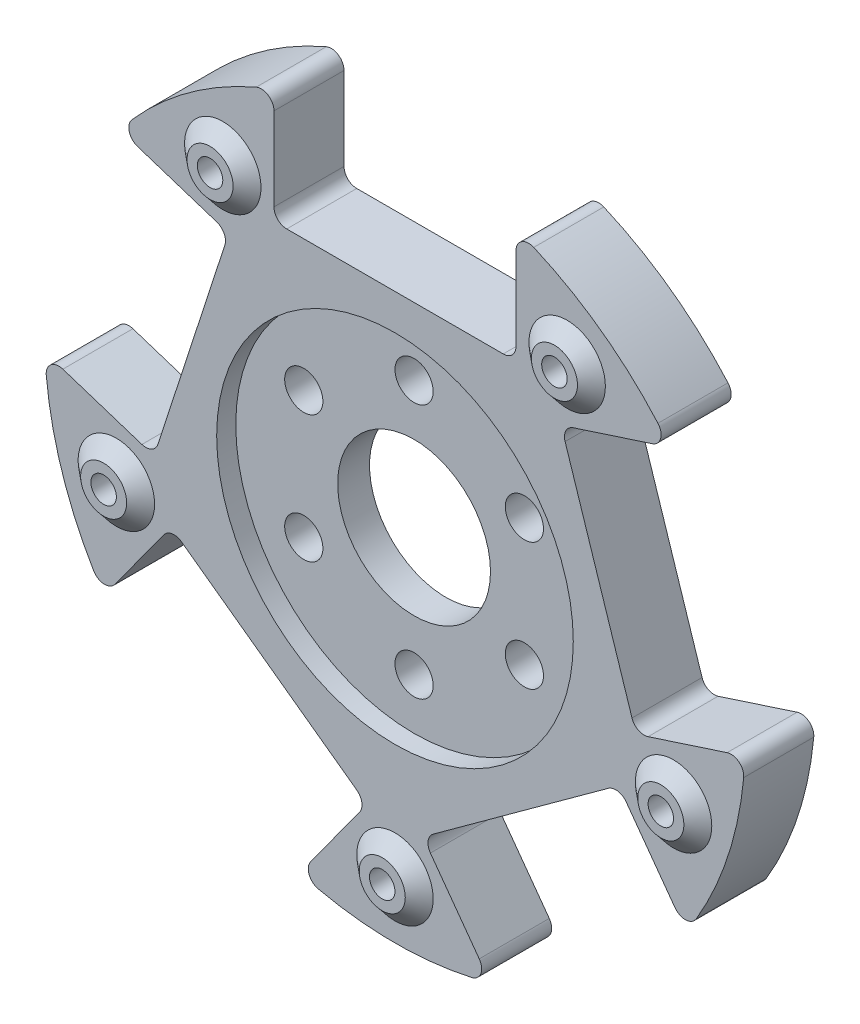
from build123d import *

# Parameters (mm, degrees)
SKETCH2_R                     = 14
BOSS_EXTRUDE1_DEPTH           = 2.75
SKETCH2_3_R                   = 14
SKETCH2_3_R_2                 = 1.5
SKETCH2_3_R_3                 = 6
BOSS_EXTRUDE2_DEPTH           = 1.25
FILLET1_R                     = 1
SKETCH3_R                     = 3
BOSS_EXTRUDE3_DEPTH           = 1
BOSS_EXTRUDE3_DRAFT           = 50
BOSS_EXTRUDE3_PROFILE_2_DEPTH = 1
BOSS_EXTRUDE3_PROFILE_2_DRAFT = 50
BOSS_EXTRUDE3_PROFILE_3_DEPTH = 1
BOSS_EXTRUDE3_PROFILE_3_DRAFT = 50
BOSS_EXTRUDE3_PROFILE_4_DEPTH = 1
BOSS_EXTRUDE3_PROFILE_4_DRAFT = 50
BOSS_EXTRUDE3_PROFILE_5_DEPTH = 1
BOSS_EXTRUDE3_PROFILE_5_DRAFT = 50
SKETCH4_R                     = 1
CUT_EXTRUDE1_DEPTH            = 2
SKETCH5_R                     = 3
BOSS_EXTRUDE5_DEPTH           = 1
BOSS_EXTRUDE5_DRAFT           = 50
BOSS_EXTRUDE5_PROFILE_2_DEPTH = 1
BOSS_EXTRUDE5_PROFILE_2_DRAFT = 50
BOSS_EXTRUDE5_PROFILE_3_DEPTH = 1
BOSS_EXTRUDE5_PROFILE_3_DRAFT = 50
BOSS_EXTRUDE5_PROFILE_4_DEPTH = 1
BOSS_EXTRUDE5_PROFILE_4_DRAFT = 50
BOSS_EXTRUDE5_PROFILE_5_DEPTH = 1
BOSS_EXTRUDE5_PROFILE_5_DRAFT = 50
CUT_EXTRUDE2_START            = -1
SKETCH6_R                     = 1
CUT_EXTRUDE2_DEPTH            = 1


with BuildPart() as part:
    # Sketch2 → Boss-Extrude1 (new, symmetric)
    with BuildSketch(Plane.XY):
        with BuildLine():
            Line((-9.5, 16.806975801), (-9.5, 25.806975801))
            ThreePointArc((-9.5, 25.806975801), (-16.164094438, 22.247967345), (-21.608231055, 17.009831001))
            Line((-21.608231055, 17.009831001), (-13.048722408, 14.228678051))
            Line((-13.048722408, 14.228678051), (-18.920045301, -3.841395758))
            Line((-18.920045301, -3.841395758), (-27.479553948, -1.060242809))
            ThreePointArc((-27.479553948, -1.060242809), (-26.154054198, -8.497967345), (-22.854621229, -15.2943221))
            Line((-22.854621229, -15.2943221), (-17.564553958, -8.01316915))
            Line((-17.564553958, -8.01316915), (-2.193231065, -19.181088944))
            Line((-2.193231065, -19.181088944), (-7.483298336, -26.462241893))
            ThreePointArc((-7.483298336, -26.462241893), (0, -27.5), (7.483298336, -26.462241893))
            Line((7.483298336, -26.462241893), (2.193231065, -19.181088944))
            Line((2.193231065, -19.181088944), (17.564553958, -8.01316915))
            Line((17.564553958, -8.01316915), (22.854621229, -15.2943221))
            ThreePointArc((22.854621229, -15.2943221), (26.154054198, -8.497967345), (27.479553948, -1.060242809))
            Line((27.479553948, -1.060242809), (18.920045301, -3.841395758))
            Line((18.920045301, -3.841395758), (13.048722408, 14.228678051))
            Line((13.048722408, 14.228678051), (21.608231055, 17.009831001))
            ThreePointArc((21.608231055, 17.009831001), (16.164094438, 22.247967345), (9.5, 25.806975801))
            Line((9.5, 25.806975801), (9.5, 16.806975801))
            Line((9.5, 16.806975801), (-9.5, 16.806975801))
        make_face()
        Circle(SKETCH2_R, mode=Mode.SUBTRACT)
    extrude(amount=BOSS_EXTRUDE1_DEPTH, both=True)

    # Sketch2<3> → Boss-Extrude2 (add, symmetric)
    with BuildSketch(Plane.XY):
        Circle(SKETCH2_3_R)
        with Locations((0, -10)):
            Circle(SKETCH2_3_R_2, mode=Mode.SUBTRACT)
        with Locations((-8.660254038, -5)):
            Circle(SKETCH2_3_R_2, mode=Mode.SUBTRACT)
        with Locations((8.660254038, -5)):
            Circle(SKETCH2_3_R_2, mode=Mode.SUBTRACT)
        with Locations((-8.660254038, 5)):
            Circle(SKETCH2_3_R_2, mode=Mode.SUBTRACT)
        Circle(SKETCH2_3_R_3, mode=Mode.SUBTRACT)
        with Locations((8.660254038, 5)):
            Circle(SKETCH2_3_R_2, mode=Mode.SUBTRACT)
        with Locations((0, 10)):
            Circle(SKETCH2_3_R_2, mode=Mode.SUBTRACT)
    extrude(amount=BOSS_EXTRUDE2_DEPTH, both=True)

    # Fillet1
    fillet1_edges = [part.edges().sort_by_distance(p)[0] for p in [
        (-18.920045301, -3.841395758, 0),
        (-13.048722408, 14.228678051, 0),
        (-17.564553958, -8.01316915, 0),
        (-2.193231065, -19.181088944, 0),
        (17.564553958, -8.01316915, 0),
        (2.193231065, -19.181088944, 0),
        (18.920045301, -3.841395758, 0),
        (13.048722408, 14.228678051, 0),
        (9.5, 16.806975801, 0),
        (-9.5, 16.806975801, 0),
        (-9.5, 25.806975801, 0),
        (9.5, 25.806975801, 0),
        (21.608231055, 17.009831001, 0),
        (27.479553948, -1.060242809, 0),
        (22.854621229, -15.2943221, 0),
        (7.483298336, -26.462241893, 0),
        (-7.483298336, -26.462241893, 0),
        (-22.854621229, -15.2943221, 0),
        (-27.479553948, -1.060242809, 0),
        (-21.608231055, 17.009831001, 0),
    ]]
    fillet(fillet1_edges, radius=FILLET1_R)


with BuildPart() as boss_extrude3_tool:
    # Sketch3 → Boss-Extrude3 (with draft: the straight prism first)
    with BuildSketch(Plane.XY.offset(2.75)):
        with Locations((13.519060803, 18.607390871)):
            Circle(SKETCH3_R)
    extrude(amount=BOSS_EXTRUDE3_DEPTH)
    # Boss-Extrude3: the draft: its side faces are tilted about the plane it starts from
    boss_extrude3_sides = [boss_extrude3_tool.faces().sort_by_distance(p)[0] for p in [
        (10.519060803, 18.607390871, 3.25),
    ]]
    draft(boss_extrude3_sides, Plane.XY.offset(2.75), BOSS_EXTRUDE3_DRAFT)


with BuildPart() as part_1:
    add(part.part)

    # Boss-Extrude3: add boss_extrude3_tool
    add(boss_extrude3_tool.part)


with BuildPart() as boss_extrude3_profile_2_tool:
    # Sketch3 → Boss-Extrude3 profile 2 (with draft: the straight prism first)
    with BuildSketch(Plane.XY.offset(2.75)):
        with Locations((21.874299875, -7.107390871)):
            Circle(SKETCH3_R)
    extrude(amount=BOSS_EXTRUDE3_PROFILE_2_DEPTH)
    # Boss-Extrude3 profile 2: the draft: its side faces are tilted about the plane it starts from
    boss_extrude3_profile_2_sides = [boss_extrude3_profile_2_tool.faces().sort_by_distance(p)[0] for p in [
        (18.874299875, -7.107390871, 3.25),
    ]]
    draft(boss_extrude3_profile_2_sides, Plane.XY.offset(2.75), BOSS_EXTRUDE3_PROFILE_2_DRAFT)


with BuildPart() as part_2:
    add(part_1.part)

    # Boss-Extrude3 profile 2: add boss_extrude3_profile_2_tool
    add(boss_extrude3_profile_2_tool.part)


with BuildPart() as boss_extrude3_profile_3_tool:
    # Sketch3 → Boss-Extrude3 profile 3 (with draft: the straight prism first)
    with BuildSketch(Plane.XY.offset(2.75)):
        with Locations((0, -23)):
            Circle(SKETCH3_R)
    extrude(amount=BOSS_EXTRUDE3_PROFILE_3_DEPTH)
    # Boss-Extrude3 profile 3: the draft: its side faces are tilted about the plane it starts from
    boss_extrude3_profile_3_sides = [boss_extrude3_profile_3_tool.faces().sort_by_distance(p)[0] for p in [
        (-3, -23, 3.25),
    ]]
    draft(boss_extrude3_profile_3_sides, Plane.XY.offset(2.75), BOSS_EXTRUDE3_PROFILE_3_DRAFT)


with BuildPart() as part_3:
    add(part_2.part)

    # Boss-Extrude3 profile 3: add boss_extrude3_profile_3_tool
    add(boss_extrude3_profile_3_tool.part)


with BuildPart() as boss_extrude3_profile_4_tool:
    # Sketch3 → Boss-Extrude3 profile 4 (with draft: the straight prism first)
    with BuildSketch(Plane.XY.offset(2.75)):
        with Locations((-21.874299875, -7.107390871)):
            Circle(SKETCH3_R)
    extrude(amount=BOSS_EXTRUDE3_PROFILE_4_DEPTH)
    # Boss-Extrude3 profile 4: the draft: its side faces are tilted about the plane it starts from
    boss_extrude3_profile_4_sides = [boss_extrude3_profile_4_tool.faces().sort_by_distance(p)[0] for p in [
        (-24.874299875, -7.107390871, 3.25),
    ]]
    draft(boss_extrude3_profile_4_sides, Plane.XY.offset(2.75), BOSS_EXTRUDE3_PROFILE_4_DRAFT)


with BuildPart() as part_4:
    add(part_3.part)

    # Boss-Extrude3 profile 4: add boss_extrude3_profile_4_tool
    add(boss_extrude3_profile_4_tool.part)


with BuildPart() as boss_extrude3_profile_5_tool:
    # Sketch3 → Boss-Extrude3 profile 5 (with draft: the straight prism first)
    with BuildSketch(Plane.XY.offset(2.75)):
        with Locations((-13.519060803, 18.607390871)):
            Circle(SKETCH3_R)
    extrude(amount=BOSS_EXTRUDE3_PROFILE_5_DEPTH)
    # Boss-Extrude3 profile 5: the draft: its side faces are tilted about the plane it starts from
    boss_extrude3_profile_5_sides = [boss_extrude3_profile_5_tool.faces().sort_by_distance(p)[0] for p in [
        (-16.519060803, 18.607390871, 3.25),
    ]]
    draft(boss_extrude3_profile_5_sides, Plane.XY.offset(2.75), BOSS_EXTRUDE3_PROFILE_5_DRAFT)


with BuildPart() as part_5:
    add(part_4.part)

    # Boss-Extrude3 profile 5: add boss_extrude3_profile_5_tool
    add(boss_extrude3_profile_5_tool.part)

    # Sketch4 → Cut-Extrude1 (cut)
    with BuildSketch(Plane.XY.offset(3.75)):
        with Locations((13.519060803, 18.607390871)):
            Circle(SKETCH4_R)
        with Locations((21.874299875, -7.107390871)):
            Circle(SKETCH4_R)
        with Locations((0, -23)):
            Circle(SKETCH4_R)
        with Locations((-21.874299875, -7.107390871)):
            Circle(SKETCH4_R)
        with Locations((-13.519060803, 18.607390871)):
            Circle(SKETCH4_R)
    extrude(amount=-CUT_EXTRUDE1_DEPTH, mode=Mode.SUBTRACT)


with BuildPart() as boss_extrude5_tool:
    # Sketch5 → Boss-Extrude5 (with draft: the straight prism first)
    with BuildSketch(Plane(origin=(0, 0, -2.75), x_dir=(-1, 0, 0), z_dir=(0, 0, -1))):
        with Locations((13.519060803, 18.607390871)):
            Circle(SKETCH5_R)
    extrude(amount=BOSS_EXTRUDE5_DEPTH)
    # Boss-Extrude5: the draft: its side faces are tilted about the plane it starts from
    boss_extrude5_sides = [boss_extrude5_tool.faces().sort_by_distance(p)[0] for p in [
        (-10.519060803, 18.607390871, -3.25),
    ]]
    draft(boss_extrude5_sides, Plane(origin=(0, 0, -2.75), x_dir=(-1, 0, 0), z_dir=(0, 0, -1)), BOSS_EXTRUDE5_DRAFT)


with BuildPart() as part_6:
    add(part_5.part)

    # Boss-Extrude5: add boss_extrude5_tool
    add(boss_extrude5_tool.part)


with BuildPart() as boss_extrude5_profile_2_tool:
    # Sketch5 → Boss-Extrude5 profile 2 (with draft: the straight prism first)
    with BuildSketch(Plane(origin=(0, 0, -2.75), x_dir=(-1, 0, 0), z_dir=(0, 0, -1))):
        with Locations((21.874299875, -7.107390871)):
            Circle(SKETCH5_R)
    extrude(amount=BOSS_EXTRUDE5_PROFILE_2_DEPTH)
    # Boss-Extrude5 profile 2: the draft: its side faces are tilted about the plane it starts from
    boss_extrude5_profile_2_sides = [boss_extrude5_profile_2_tool.faces().sort_by_distance(p)[0] for p in [
        (-18.874299875, -7.107390871, -3.25),
    ]]
    draft(boss_extrude5_profile_2_sides, Plane(origin=(0, 0, -2.75), x_dir=(-1, 0, 0), z_dir=(0, 0, -1)), BOSS_EXTRUDE5_PROFILE_2_DRAFT)


with BuildPart() as part_7:
    add(part_6.part)

    # Boss-Extrude5 profile 2: add boss_extrude5_profile_2_tool
    add(boss_extrude5_profile_2_tool.part)


with BuildPart() as boss_extrude5_profile_3_tool:
    # Sketch5 → Boss-Extrude5 profile 3 (with draft: the straight prism first)
    with BuildSketch(Plane(origin=(0, 0, -2.75), x_dir=(-1, 0, 0), z_dir=(0, 0, -1))):
        with Locations((0, -23)):
            Circle(SKETCH5_R)
    extrude(amount=BOSS_EXTRUDE5_PROFILE_3_DEPTH)
    # Boss-Extrude5 profile 3: the draft: its side faces are tilted about the plane it starts from
    boss_extrude5_profile_3_sides = [boss_extrude5_profile_3_tool.faces().sort_by_distance(p)[0] for p in [
        (3, -23, -3.25),
    ]]
    draft(boss_extrude5_profile_3_sides, Plane(origin=(0, 0, -2.75), x_dir=(-1, 0, 0), z_dir=(0, 0, -1)), BOSS_EXTRUDE5_PROFILE_3_DRAFT)


with BuildPart() as part_8:
    add(part_7.part)

    # Boss-Extrude5 profile 3: add boss_extrude5_profile_3_tool
    add(boss_extrude5_profile_3_tool.part)


with BuildPart() as boss_extrude5_profile_4_tool:
    # Sketch5 → Boss-Extrude5 profile 4 (with draft: the straight prism first)
    with BuildSketch(Plane(origin=(0, 0, -2.75), x_dir=(-1, 0, 0), z_dir=(0, 0, -1))):
        with Locations((-21.874299875, -7.107390871)):
            Circle(SKETCH5_R)
    extrude(amount=BOSS_EXTRUDE5_PROFILE_4_DEPTH)
    # Boss-Extrude5 profile 4: the draft: its side faces are tilted about the plane it starts from
    boss_extrude5_profile_4_sides = [boss_extrude5_profile_4_tool.faces().sort_by_distance(p)[0] for p in [
        (24.874299875, -7.107390871, -3.25),
    ]]
    draft(boss_extrude5_profile_4_sides, Plane(origin=(0, 0, -2.75), x_dir=(-1, 0, 0), z_dir=(0, 0, -1)), BOSS_EXTRUDE5_PROFILE_4_DRAFT)


with BuildPart() as part_9:
    add(part_8.part)

    # Boss-Extrude5 profile 4: add boss_extrude5_profile_4_tool
    add(boss_extrude5_profile_4_tool.part)


with BuildPart() as boss_extrude5_profile_5_tool:
    # Sketch5 → Boss-Extrude5 profile 5 (with draft: the straight prism first)
    with BuildSketch(Plane(origin=(0, 0, -2.75), x_dir=(-1, 0, 0), z_dir=(0, 0, -1))):
        with Locations((-13.519060803, 18.607390871)):
            Circle(SKETCH5_R)
    extrude(amount=BOSS_EXTRUDE5_PROFILE_5_DEPTH)
    # Boss-Extrude5 profile 5: the draft: its side faces are tilted about the plane it starts from
    boss_extrude5_profile_5_sides = [boss_extrude5_profile_5_tool.faces().sort_by_distance(p)[0] for p in [
        (16.519060803, 18.607390871, -3.25),
    ]]
    draft(boss_extrude5_profile_5_sides, Plane(origin=(0, 0, -2.75), x_dir=(-1, 0, 0), z_dir=(0, 0, -1)), BOSS_EXTRUDE5_PROFILE_5_DRAFT)


with BuildPart() as part_10:
    add(part_9.part)

    # Boss-Extrude5 profile 5: add boss_extrude5_profile_5_tool
    add(boss_extrude5_profile_5_tool.part)

    # Sketch6 → Cut-Extrude2 (cut)
    with BuildSketch(Plane(origin=(0, 0, -3.75), x_dir=(-1, 0, 0), z_dir=(0, 0, -1)).offset(CUT_EXTRUDE2_START)):
        with Locations((13.519060803, 18.607390871)):
            Circle(SKETCH6_R)
        with Locations((21.874299875, -7.107390871)):
            Circle(SKETCH6_R)
        with Locations((0, -23)):
            Circle(SKETCH6_R)
        with Locations((-21.874299875, -7.107390871)):
            Circle(SKETCH6_R)
        with Locations((-13.519060803, 18.607390871)):
            Circle(SKETCH6_R)
    extrude(amount=CUT_EXTRUDE2_DEPTH, mode=Mode.SUBTRACT)


solid = part_10.part
